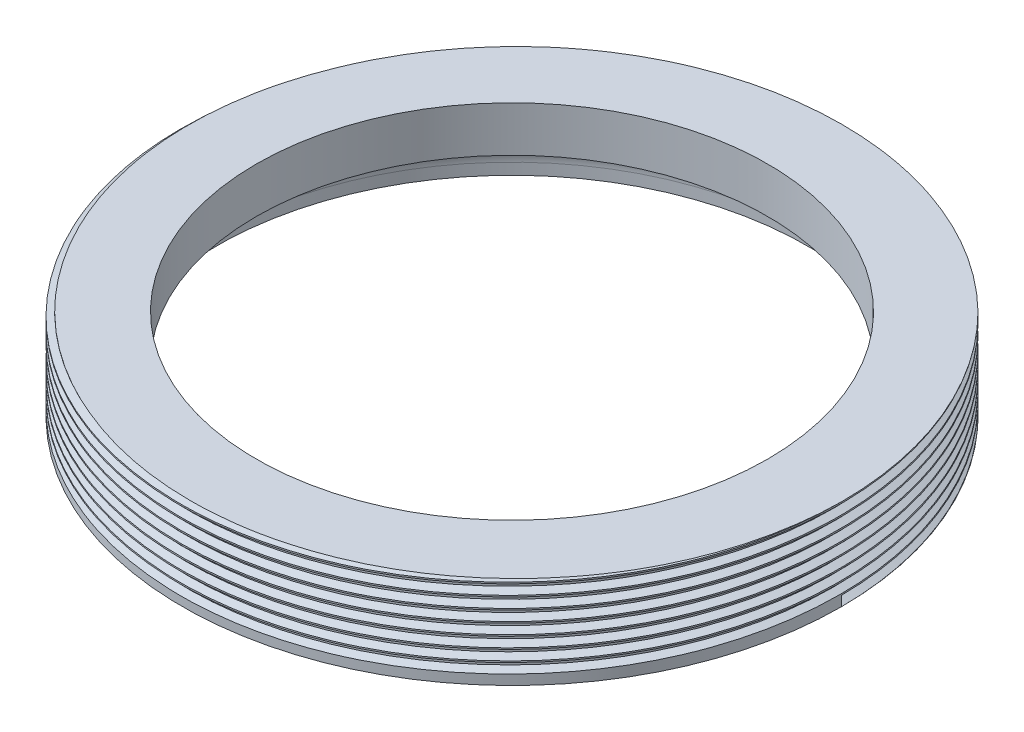
from build123d import *

# Parameters (mm, degrees)
THREAD1_PITCH = 1


with BuildPart() as part:
    # Sketch2 → Revolve1 (revolve)
    with BuildSketch(Plane(origin=(0, 0, 0), x_dir=(-1, 0, 0), z_dir=(0, 0, -1)), mode=Mode.PRIVATE) as revolve1_sk:
        with BuildLine():
            Line((22.5, 4), (22.5, 8))
            Line((22.5, 8), (29, 8))
            Line((29, 8), (29, 0))
            Line((29, 0), (26, 0))
            Line((26, 0), (26, 1))
            ThreePointArc((26, 1), (25.121320344, 3.121320344), (23, 4))
            Line((23, 4), (22.5, 4))
        make_face()
    revolve(revolve1_sk.sketch.rotate(Axis((0, 0, 0), (0, 1, 0)), 180), axis=Axis((0, 0, 0), (0, 1, 0)))

    # Thread1: the profile of Thread Profile1 profile screwed along a right-hand helix of 8 turns, 8 arcs to a turn; built about Z, then put on its axis
    thread1_z = Axis((0, 0, 0), (0, 0, 1))
    thread1_corners = [(29.0003, 0, -0.000173205), (29.0003, 0, 0.875173202), (28.458734125, 0, 0.562499999), (28.458734125, 0, 0.312499999)]
    with BuildLine(mode=Mode.PRIVATE) as thread1_profile:
        Line(thread1_corners[0], thread1_corners[1])
        Line(thread1_corners[1], thread1_corners[2])
        Line(thread1_corners[2], thread1_corners[3])
        Line(thread1_corners[3], thread1_corners[0])
    thread1_cap = Face(thread1_profile.wire())
    thread1_turn_angles = [0, 22.5, 45, 67.5, 90, 112.5, 135, 157.5, 180, 202.5, 225, 247.5, 270, 292.5, 315, 337.5, 360]
    thread1_turn_weights = [1, 0.9238795325112867, 1, 0.9238795325112867, 1, 0.9238795325112867, 1, 0.9238795325112867, 1, 0.9238795325112867, 1, 0.9238795325112867, 1, 0.9238795325112867, 1, 0.9238795325112867, 1]
    thread1_turn_rails = [Edge.make_bspline([Vector(p[0], p[1], 0).rotate(thread1_z, thread1_turn_angles[k]) / thread1_turn_weights[k] + Vector(0, 0, p[2] + THREAD1_PITCH * thread1_turn_angles[k] / 360) for k in range(17)], [0, 0, 0, 1, 1, 2, 2, 3, 3, 4, 4, 5, 5, 6, 6, 7, 7, 8, 8, 8], 2, thread1_turn_weights) for p in thread1_corners]
    thread1_turn_sides = [Face.make_surface_from_curves(thread1_turn_rails[p[0]], thread1_turn_rails[p[1]]) for p in [(0, 1), (1, 2), (2, 3), (3, 0)]]
    thread1 = Plane(origin=(0, 0, 0), x_dir=(1, 0, 0), z_dir=(0, 1, 0)) * Solid(Shell([*[p.moved(Location((0, 0, THREAD1_PITCH * i))) for i in range(8) for p in thread1_turn_sides], thread1_cap, thread1_cap.rotate(thread1_z, 2880).moved(Location((0, 0, THREAD1_PITCH * 2880 / 360)))]))
    add(thread1, mode=Mode.SUBTRACT)


solid = part.part
